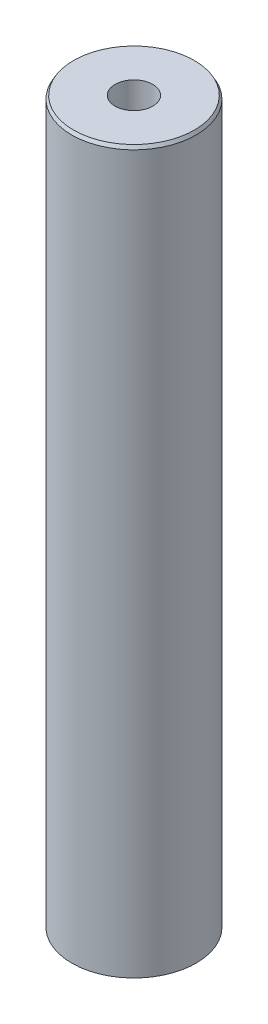
from build123d import *
from OCP.BRepFilletAPI import BRepFilletAPI_MakeChamfer

# Parameters (mm, degrees)
SKETCH1_R           = 42.5
BOSS_EXTRUDE1_DEPTH = 493.227366185
SKETCH2_R           = 12.885418413
CUT_EXTRUDE1_DEPTH  = 497.875975223
CHAMFER1_SIZE       = 2.23835676
CHAMFER1_SIZE2      = 1.292315878


with BuildPart() as part:
    # Sketch1 → Boss-Extrude1 (new body)
    with BuildSketch(Plane(origin=(0, 0, 0), x_dir=(1, 0, 0), z_dir=(0, 1, 0))):
        Circle(SKETCH1_R)
    extrude(amount=BOSS_EXTRUDE1_DEPTH)

    # Sketch2 → Cut-Extrude1 (cut, through all)
    with BuildSketch(Plane(origin=(0, 0, 0), x_dir=(1, 0, 0), z_dir=(0, 1, 0))):
        Circle(SKETCH2_R)
    extrude(amount=CUT_EXTRUDE1_DEPTH, mode=Mode.SUBTRACT)

    # Chamfer1: one chamfer whose edges measure the first distance from different faces: ONE call of the kernel's chamfer builder (chamfer() names one face for all edges)
    chamfer1_edges_1 = [part.edges().sort_by_distance(p)[0] for p in [
        (-42.5, 493.227366185, 0),
    ]]
    chamfer1_side_1 = [part.faces().sort_by_distance(p)[0] for p in [
        (-42.5, 246.613683092, 0),
    ]]
    chamfer1_edges_2 = [part.edges().sort_by_distance(p)[0] for p in [
        (-42.5, 0, 0),
    ]]
    chamfer1_side_2 = [part.faces().sort_by_distance(p)[0] for p in [
        (-41.297918472, 0, 0),
    ]]
    chamfer1 = BRepFilletAPI_MakeChamfer(part.part.solid().wrapped)
    for e in chamfer1_edges_1:
        chamfer1.Add(CHAMFER1_SIZE, CHAMFER1_SIZE2, e.wrapped, chamfer1_side_1[0].wrapped)  # the first distance lies on this face
    for e in chamfer1_edges_2:
        chamfer1.Add(CHAMFER1_SIZE, CHAMFER1_SIZE2, e.wrapped, chamfer1_side_2[0].wrapped)  # the first distance lies on this face
    add(Compound.cast(chamfer1.Shape()), mode=Mode.REPLACE)


solid = part.part
